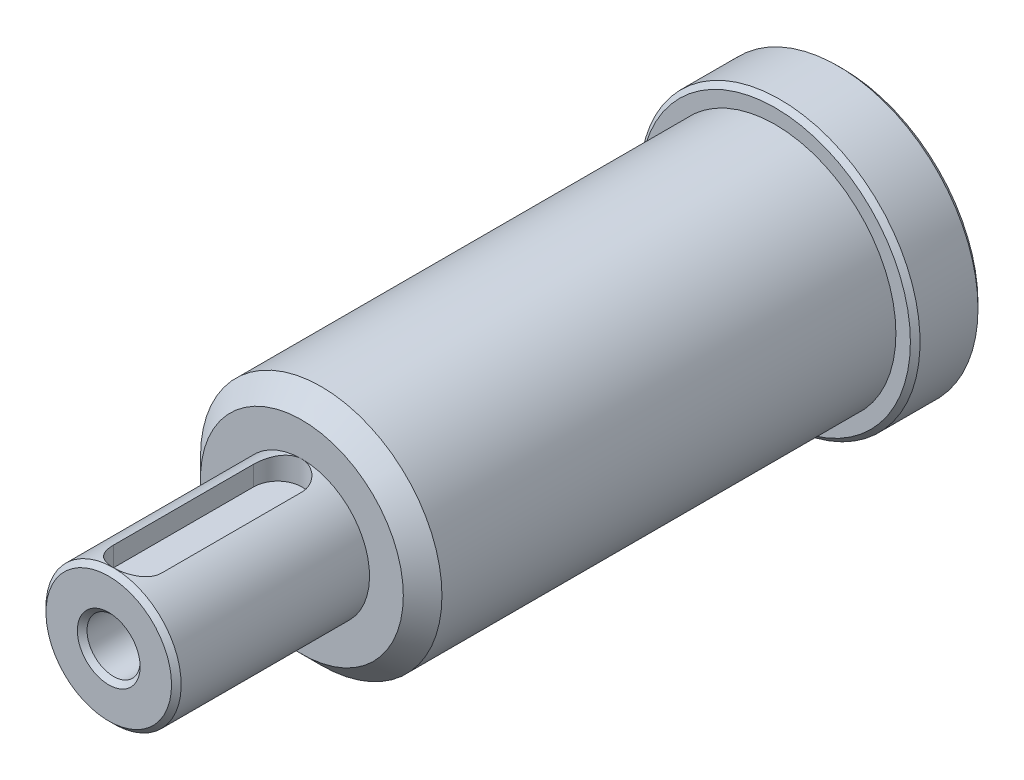
from build123d import *

# Parameters (mm, degrees)
SKETCH_1_R          = 12.5
EXTRUDE_1_DEPTH     = 56
SKETCH_4_R          = 7
EXTRUDE_2_DEPTH     = 3
SKETCH_7_R          = 7
EXTRUDE_3_DEPTH     = 20
CHAMFER_1_SIZE      = 2
SKETCH_8_R          = 7
CUT_EXTRUDE_3_DEPTH = 33.5
SKETCH_9_R          = 14.5
SKETCH_9_R_2        = 12.5
EXTRUDE_4_DEPTH     = 7
SKETCH_10_R         = 2.75
CUT_EXTRUDE_4_DEPTH = 79.71785058
CUT_EXTRUDE_5_DEPTH = 2.5
SKETCH_12_W         = 5
SKETCH_12_H         = 4.425702811
CUT_EXTRUDE_6_DEPTH = 30
CHAMFER_2_SIZE      = 0.5
CHAMFER_3_SIZE      = 0.5
CHAMFER_4_SIZE      = 0.5
CHAMFER_5_SIZE      = 0.5
FILLET_1_R          = 1


with BuildPart() as part:
    # 草图1 → 拉伸1 (new body)
    with BuildSketch(Plane.XY):
        Circle(SKETCH_1_R)
    extrude(amount=EXTRUDE_1_DEPTH)

    # 草图4 → 拉伸2 (add)
    with BuildSketch(Plane.XY.offset(56)):
        Circle(SKETCH_4_R)
    extrude(amount=-EXTRUDE_2_DEPTH)

    # 草图7 → 拉伸3 (add)
    with BuildSketch(Plane.XY.offset(56)):
        Circle(SKETCH_7_R)
    extrude(amount=EXTRUDE_3_DEPTH)

    # 倒角1
    chamfer_1_edges = [part.edges().sort_by_distance(p)[0] for p in [
        (-12.5, 0, 56),
    ]]
    chamfer(chamfer_1_edges, length=CHAMFER_1_SIZE)

    # 草图8 → 切除-拉伸3 (cut)
    with BuildSketch(Plane(origin=(0, 0, 0), x_dir=(-1, 0, 0), z_dir=(0, 0, -1))):
        with Locations(Location((0, 0, 0), (0, 0, 180))):
            Circle(SKETCH_8_R)
    extrude(amount=-CUT_EXTRUDE_3_DEPTH, mode=Mode.SUBTRACT)

    # 草图9 → 拉伸4 (add)
    with BuildSketch(Plane(origin=(0, 0, 0), x_dir=(-1, 0, 0), z_dir=(0, 0, -1))):
        Circle(SKETCH_9_R)
        Circle(SKETCH_9_R_2, mode=Mode.SUBTRACT)
    extrude(amount=-EXTRUDE_4_DEPTH)

    # 草图10 → 切除-拉伸4 (cut, through all)
    with BuildSketch(Plane.XY.offset(76)):
        Circle(SKETCH_10_R)
    extrude(amount=-CUT_EXTRUDE_4_DEPTH, mode=Mode.SUBTRACT)

    # 草图11 → 切除-拉伸5 (cut)
    with BuildSketch(Plane(origin=(0, 7, 0), x_dir=(-1, 0, 0), z_dir=(0, 1, 0))):
        with BuildLine():
            Line((-2.5, 73), (-2.5, 58.5))
            ThreePointArc((-2.5, 58.5), (0, 56), (2.5, 58.5))
            Line((2.5, 58.5), (2.5, 73))
            ThreePointArc((2.5, 73), (0, 75.5), (-2.5, 73))
        make_face()
    extrude(amount=-CUT_EXTRUDE_5_DEPTH, mode=Mode.SUBTRACT)

    # 草图12 → 切除-拉伸6 (cut)
    with BuildSketch(Plane(origin=(0, 0, 0), x_dir=(-1, 0, 0), z_dir=(0, 0, -1))):
        with Locations((0, 6.787148594)):
            Rectangle(SKETCH_12_W, SKETCH_12_H)
    extrude(amount=-CUT_EXTRUDE_6_DEPTH, mode=Mode.SUBTRACT)

    # 倒角2
    chamfer_2_edges = [part.edges().sort_by_distance(p)[0] for p in [
        (14.5, 0, 7),
        (14.5, 0, 0),
        (-3.968626967, -5.766281297, 0),
    ]]
    chamfer(chamfer_2_edges, length=CHAMFER_2_SIZE)

    # 倒角3
    chamfer_3_edges = [part.edges().sort_by_distance(p)[0] for p in [
        (-7, 0, 76),
    ]]
    chamfer(chamfer_3_edges, length=CHAMFER_3_SIZE - 0.0001)  # a hair under: the kernel refuses the full size

    # 倒角4
    chamfer_4_edges = [part.edges().sort_by_distance(p)[0] for p in [
        (-2.75, 0, 76),
    ]]
    chamfer(chamfer_4_edges, length=CHAMFER_4_SIZE)

    # 倒角5
    chamfer_5_edges = [part.edges().sort_by_distance(p)[0] for p in [
        (-2.75, 0, 33.5),
    ]]
    chamfer(chamfer_5_edges, length=CHAMFER_5_SIZE)

    # 圆角1
    fillet_1_edges = [part.edges().sort_by_distance(p)[0] for p in [
        (-7, 0, 33.5),
    ]]
    fillet(fillet_1_edges, radius=FILLET_1_R)


solid = part.part
